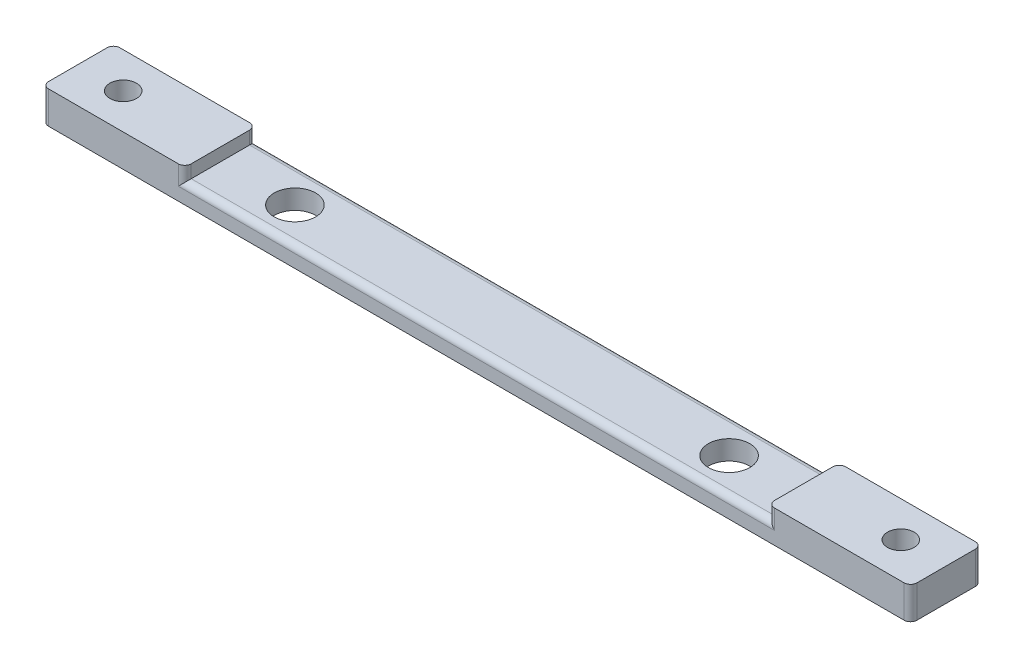
from build123d import *

# Parameters (mm, degrees)
ESQUISSE1_R             = 2.05
ESQUISSE1_R_2           = 3.2
BOSS_EXTRU_1_DEPTH      = 5
ESQUISSE2_W             = 90
ESQUISSE2_H             = 2
ENL_V_MAT_EXTRU_1_DEPTH = 69.080834307
CONG_1_R                = 1


with BuildPart() as part:
    # Esquisse1 → Boss.-Extru.1 (new body)
    with BuildSketch(Plane(origin=(0, 0, 0), x_dir=(1, 0, 0), z_dir=(0, 1, 0))):
        with BuildLine():
            Line((-66, 0), (66, 0))
            ThreePointArc((66, 0), (66.707106781, 0.292893219), (67, 1))
            Line((67, 1), (67, 10))
            ThreePointArc((67, 10), (66.707106781, 10.707106781), (66, 11))
            Line((66, 11), (-66, 11))
            ThreePointArc((-66, 11), (-66.707106781, 10.707106781), (-67, 10))
            Line((-67, 10), (-67, 1))
            ThreePointArc((-67, 1), (-66.707106781, 0.292893219), (-66, 0))
        make_face()
        with Locations((60, 5.5)):
            Circle(ESQUISSE1_R, mode=Mode.SUBTRACT)
        with Locations((33.5, 5.5)):
            Circle(ESQUISSE1_R_2, mode=Mode.SUBTRACT)
        with Locations((-33.5, 5.5)):
            Circle(ESQUISSE1_R_2, mode=Mode.SUBTRACT)
        with Locations((-60, 5.5)):
            Circle(ESQUISSE1_R, mode=Mode.SUBTRACT)
    extrude(amount=BOSS_EXTRU_1_DEPTH)

    # Esquisse2 → Enlèv. mat.-Extru.1 (cut, through all)
    with BuildSketch(Plane.XY):
        with Locations((0, 4)):
            Rectangle(ESQUISSE2_W, ESQUISSE2_H)
    extrude(amount=-ENL_V_MAT_EXTRU_1_DEPTH, mode=Mode.SUBTRACT)

    # Congé1
    cong_1_edges = [part.edges().sort_by_distance(p)[0] for p in [
        (0, 3, -11),
        (45, 4, -11),
        (45, 4, 0),
        (0, 3, 0),
        (-45, 4, -11),
        (-45, 4, 0),
    ]]
    fillet(cong_1_edges, radius=CONG_1_R)


solid = part.part
